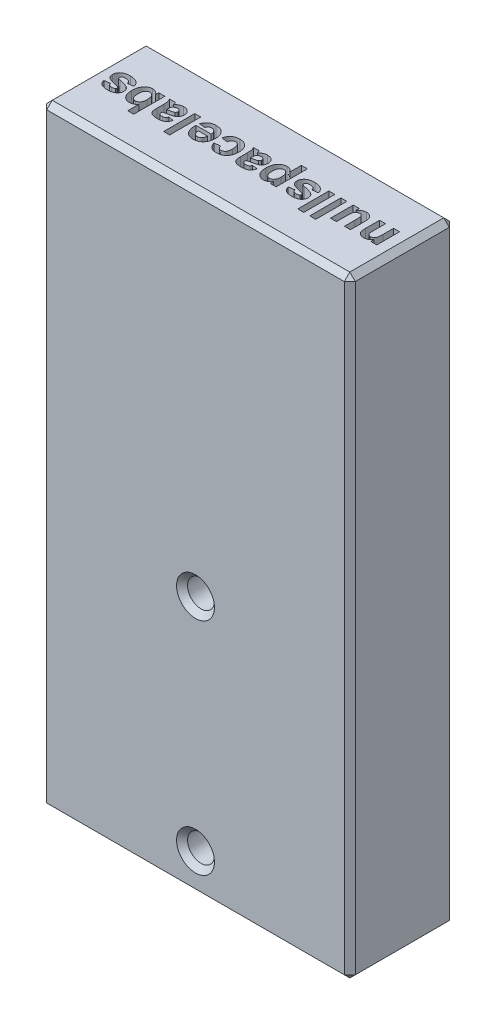
from build123d import *

# Parameters (mm, degrees)
SKETCH1_W           = 28
SKETCH1_H           = 55.475
BOSS_EXTRUDE1_DEPTH = 9.525
SKETCH2_R           = 1.2195
CUT_EXTRUDE1_DEPTH  = 20
SKETCH3_R           = 1.2195
CUT_EXTRUDE2_DEPTH  = 63.866535215
CHAMFER1_SIZE       = 0.5
CHAMFER2_SIZE       = 0.5
SKETCH4_W           = 0.543298183
SKETCH4_H           = 2.825150553
SKETCH4_W_2         = 0.543298184
CUT_EXTRUDE3_DEPTH  = 1.5875


with BuildPart() as part:
    # Sketch1 → Boss-Extrude1 (new body)
    with BuildSketch(Plane.XY):
        with Locations((14, 27.7375)):
            Rectangle(SKETCH1_W, SKETCH1_H)
    extrude(amount=BOSS_EXTRUDE1_DEPTH)

    # Sketch2 → Cut-Extrude1 (cut)
    with BuildSketch(Plane.XZ):
        with Locations((5, 4.7625)):
            Circle(SKETCH2_R)
        with Locations((23, 4.7625)):
            Circle(SKETCH2_R)
    extrude(amount=-CUT_EXTRUDE1_DEPTH, mode=Mode.SUBTRACT)

    # Sketch3 → Cut-Extrude2 (cut, through all)
    with BuildSketch(Plane.XY.offset(9.525)):
        with Locations((14, 3.475)):
            Circle(SKETCH3_R)
        with Locations((14, 23.475)):
            Circle(SKETCH3_R)
    extrude(amount=-CUT_EXTRUDE2_DEPTH, mode=Mode.SUBTRACT)

    # Chamfer1
    chamfer1_edges = [part.edges().sort_by_distance(p)[0] for p in [
        (14, 0, 0),
        (28, 0, 4.7625),
        (28, 27.7375, 0),
        (14, 55.475, 0),
        (28, 55.475, 4.7625),
        (28, 27.7375, 9.525),
        (14, 55.475, 9.525),
        (14, 0, 9.525),
        (0, 0, 4.7625),
        (0, 27.7375, 0),
        (0, 55.475, 4.7625),
        (0, 27.7375, 9.525),
    ]]
    chamfer(chamfer1_edges, length=CHAMFER1_SIZE)

    # Chamfer2
    chamfer2_edges = [part.edges().sort_by_distance(p)[0] for p in [
        (21.7805, 0, 4.7625),
        (3.7805, 0, 4.7625),
        (12.7805, 3.475, 0),
        (12.7805, 23.475, 0),
        (12.7805, 3.475, 9.525),
        (12.7805, 23.475, 9.525),
    ]]
    chamfer(chamfer2_edges, length=CHAMFER2_SIZE)

    # Sketch4 → Cut-Extrude3 (cut)
    # profile 1 of 13: a face of its own
    with BuildSketch(Plane(origin=(0, 55.475, 0), x_dir=(-1, 0, 0), z_dir=(0, 1, 0))):
        with BuildLine():
            Line((-24.781421278, 3.604081297), (-25.324719461, 3.604081297))
            Line((-25.324719461, 3.604081297), (-25.324719461, 4.663512754))
            add(Edge.make_bspline(
                [(-25.324719461, 4.663512754), (-25.324800701, 4.690301885), (-25.324955761, 4.741433597), (-25.326848857, 4.814249772), (-25.328886968, 4.879732028), (-25.3321634, 4.9376772), (-25.336663606, 4.988453041), (-25.342018688, 5.031743594), (-25.348764077, 5.067636842), (-25.358334688, 5.105073856), (-25.373361809, 5.144799809), (-25.397749784, 5.185945368), (-25.426021426, 5.222479857), (-25.460269303, 5.252367027), (-25.49865192, 5.276467486), (-25.5407946, 5.294234463), (-25.587005296, 5.304609524), (-25.61895282, 5.305801353), (-25.63541811, 5.306415605)],
                knots=[0, 0, 0, 0, 1.585090075, 3.025419896, 4.30986405, 5.461533023, 6.458985685, 7.325703005, 8.041573048, 8.618245387, 9.611190897, 10.541623111, 11.439410311, 12.333024322, 13.215695708, 14.111259627, 15.026570636, 16, 16, 16, 16], degree=3))
            add(Edge.make_bspline(
                [(-25.63541811, 5.306415605), (-25.656617157, 5.305363327), (-25.698363813, 5.303291108), (-25.75966224, 5.288937779), (-25.816913906, 5.2635167), (-25.870356846, 5.229581438), (-25.917481625, 5.1874434), (-25.957549451, 5.138230589), (-25.989151824, 5.082560419), (-26.008840988, 5.030580648), (-26.020524332, 4.983531769), (-26.028475228, 4.941037319), (-26.034171522, 4.891452971), (-26.040188151, 4.835282747), (-26.043582029, 4.771998131), (-26.047368963, 4.702225524), (-26.048763232, 4.62541148), (-26.048995555, 4.572019608), (-26.049117039, 4.544100341)],
                knots=[0, 0, 0, 0, 1.032418065, 2.033110358, 3.045378521, 4.070039643, 5.104744895, 6.110696385, 7.147805894, 8.209255037, 8.806501049, 9.507534436, 10.313289552, 11.236712342, 12.258650821, 13.399345464, 14.640085731, 16, 16, 16, 16], degree=3))
            Line((-26.049117039, 4.544100341), (-26.049117039, 3.604081297))
            Line((-26.049117039, 3.604081297), (-26.592415223, 3.604081297))
            Line((-26.592415223, 3.604081297), (-26.592415223, 5.668614394))
            Line((-26.592415223, 5.668614394), (-26.049117039, 5.668614394))
            Line((-26.049117039, 5.668614394), (-26.049117039, 5.370932264))
            add(Edge.make_bspline(
                [(-26.049117039, 5.370932264), (-26.028112454, 5.397397856), (-25.987193613, 5.448955235), (-25.918688016, 5.51747586), (-25.846134249, 5.57562659), (-25.769205102, 5.623094406), (-25.687940039, 5.659734813), (-25.602711265, 5.685540576), (-25.513448534, 5.702234715), (-25.452507965, 5.703957515), (-25.42149445, 5.704834272)],
                knots=[0, 0, 0, 0, 1.096260936, 2.135615983, 3.138008533, 4.108575778, 5.062498258, 6.023394349, 6.994077526, 8, 8, 8, 8], degree=3))
            add(Edge.make_bspline(
                [(-25.42149445, 5.704834272), (-25.394278108, 5.70414993), (-25.34068123, 5.702802262), (-25.26232215, 5.689866555), (-25.187503423, 5.669555655), (-25.117268188, 5.641225429), (-25.052698522, 5.60744186), (-24.995970031, 5.567941957), (-24.947208855, 5.524381335), (-24.907218545, 5.475475745), (-24.874660325, 5.42285056), (-24.846321483, 5.367626561), (-24.824422883, 5.308501971), (-24.807520093, 5.244257422), (-24.796061131, 5.171436776), (-24.786926296, 5.086850879), (-24.782317337, 4.988409639), (-24.781732424, 4.918187159), (-24.781421278, 4.880832028)],
                knots=[0, 0, 0, 0, 1.087471829, 2.141547729, 3.166311014, 4.181815879, 5.163737, 6.073971965, 6.939083136, 7.769667735, 8.590016746, 9.409741311, 10.247555639, 11.105633939, 12.06171977, 13.192085209, 14.506318385, 16, 16, 16, 16], degree=3))
            Line((-24.781421278, 4.880832028), (-24.781421278, 3.604081297))
        make_face()
    # profile 2 of 13: a face of its own
    with BuildSketch(Plane(origin=(0, 55.475, 0), x_dir=(-1, 0, 0), z_dir=(0, 1, 0))):
        with BuildLine():
            Line((-22.934207455, 3.604081297), (-22.934207455, 3.907988718))
            add(Edge.make_bspline(
                [(-22.934207455, 3.907988718), (-22.95219541, 3.881977239), (-22.987890248, 3.830360723), (-23.053486997, 3.762721781), (-23.126944314, 3.704031061), (-23.207750233, 3.655117075), (-23.293423572, 3.616104138), (-23.382529651, 3.588092974), (-23.474039435, 3.571266192), (-23.53591723, 3.568997988), (-23.566923464, 3.567861418)],
                knots=[0, 0, 0, 0, 1.012300957, 2.008784164, 3.006972158, 4.019128624, 5.028517728, 6.017265291, 7.006475003, 8, 8, 8, 8], degree=3))
            add(Edge.make_bspline(
                [(-23.566923464, 3.567861418), (-23.598317693, 3.568900652), (-23.659886562, 3.570938749), (-23.749595886, 3.588410916), (-23.834277599, 3.616968181), (-23.913510395, 3.656236229), (-23.984645838, 3.706496501), (-24.046574428, 3.76600582), (-24.096620454, 3.835689581), (-24.129861543, 3.900483044), (-24.150721347, 3.957449305), (-24.164057626, 4.004639904), (-24.176147787, 4.055751025), (-24.185424468, 4.110786084), (-24.19295033, 4.16968324), (-24.197678886, 4.232401949), (-24.201350923, 4.29919619), (-24.201715686, 4.345073957), (-24.201903216, 4.368660303)],
                knots=[0, 0, 0, 0, 1.289498181, 2.528902495, 3.740215999, 4.953909685, 6.150063847, 7.307074614, 8.467199117, 9.660131987, 10.288158488, 10.958106275, 11.674712228, 12.445953132, 13.25095176, 14.114470792, 15.030625377, 16, 16, 16, 16], degree=3))
            Line((-24.201903216, 4.368660303), (-24.201903216, 5.668614394))
            Line((-24.201903216, 5.668614394), (-23.658605032, 5.668614394))
            Line((-23.658605032, 5.668614394), (-23.658605032, 4.716144766))
            add(Edge.make_bspline(
                [(-23.658605032, 4.716144766), (-23.658445732, 4.681434153), (-23.658143573, 4.615595348), (-23.657263916, 4.522014327), (-23.654850151, 4.439200971), (-23.652271636, 4.366921297), (-23.648448273, 4.305199992), (-23.643490751, 4.25403946), (-23.63795673, 4.213434454), (-23.630390457, 4.173849659), (-23.614855476, 4.134120128), (-23.593457323, 4.091443201), (-23.564205273, 4.054809763), (-23.530366248, 4.022992727), (-23.490933625, 3.996627978), (-23.445447966, 3.97998014), (-23.395915357, 3.967553721), (-23.361011503, 3.966716569), (-23.342812963, 3.966280086)],
                knots=[0, 0, 0, 0, 1.799930418, 3.414093185, 4.852592097, 6.095879458, 7.164323302, 8.058836106, 8.760219181, 9.289718358, 10.143846288, 10.96209893, 11.756558504, 12.559405005, 13.365225682, 14.195378484, 15.059087384, 16, 16, 16, 16], degree=3))
            add(Edge.make_bspline(
                [(-23.342812963, 3.966280086), (-23.321800233, 3.967327292), (-23.280421791, 3.969389458), (-23.219946811, 3.983760405), (-23.163468591, 4.008718213), (-23.110804659, 4.04191708), (-23.064697362, 4.083020724), (-23.024659679, 4.128674824), (-22.99347173, 4.179409236), (-22.973585002, 4.226693669), (-22.96166786, 4.271477494), (-22.955129223, 4.315926619), (-22.947955119, 4.37019967), (-22.943568417, 4.435038576), (-22.938635585, 4.51008395), (-22.93625384, 4.595589057), (-22.93446147, 4.691423847), (-22.934295075, 4.758777262), (-22.934207455, 4.79424388)],
                knots=[0, 0, 0, 0, 0.960139447, 1.890714513, 2.821289579, 3.770841791, 4.723832156, 5.63466777, 6.536687779, 7.433335375, 7.968708987, 8.650470788, 9.484586637, 10.470508532, 11.619255361, 12.921832212, 14.379114108, 16, 16, 16, 16], degree=3))
            Line((-22.934207455, 4.79424388), (-22.934207455, 5.668614394))
            Line((-22.934207455, 5.668614394), (-22.390909271, 5.668614394))
            Line((-22.390909271, 5.668614394), (-22.390909271, 3.604081297))
            Line((-22.390909271, 3.604081297), (-22.934207455, 3.604081297))
        make_face()
    # profile 3 of 13: a face of its own
    with BuildSketch(Plane(origin=(0, 55.475, 0), x_dir=(-1, 0, 0), z_dir=(0, 1, 0))):
        with Locations((-21.539742118, 5.016656574)):
            Rectangle(SKETCH4_W, SKETCH4_H)
    # profile 4 of 13: a face of its own
    with BuildSketch(Plane(origin=(0, 55.475, 0), x_dir=(-1, 0, 0), z_dir=(0, 1, 0))):
        with Locations((-20.45314575, 5.016656574)):
            Rectangle(SKETCH4_W, SKETCH4_H)
    # profile 5 of 13: a face of its own
    with BuildSketch(Plane(origin=(0, 55.475, 0), x_dir=(-1, 0, 0), z_dir=(0, 1, 0))):
        with BuildLine():
            Line((-19.855517749, 4.219819238), (-19.312219566, 4.292258996))
            add(Edge.make_bspline(
                [(-19.312219566, 4.292258996), (-19.305699456, 4.266883326), (-19.293140098, 4.21800345), (-19.261327903, 4.151551941), (-19.221447656, 4.094006125), (-19.171196133, 4.046777795), (-19.110896296, 4.009597074), (-19.039652776, 3.984797574), (-18.958487397, 3.96854445), (-18.900685094, 3.967061556), (-18.870223856, 3.966280086)],
                knots=[0, 0, 0, 0, 1.039319445, 2.001988807, 2.911187514, 3.807680854, 4.723381073, 5.705509029, 6.790826147, 8, 8, 8, 8], degree=3))
            add(Edge.make_bspline(
                [(-18.870223856, 3.966280086), (-18.836930453, 3.966867536), (-18.774309846, 3.967972455), (-18.68748318, 3.983306626), (-18.612044708, 4.004607133), (-18.570616704, 4.030077258), (-18.551036173, 4.042115457)],
                knots=[0, 0, 0, 0, 1.198418162, 2.254070348, 3.174803892, 4, 4, 4, 4], degree=3))
            add(Edge.make_bspline(
                [(-18.551036173, 4.042115457), (-18.539867545, 4.051182242), (-18.518146916, 4.068815228), (-18.496105006, 4.104292545), (-18.481433281, 4.14323304), (-18.479933841, 4.171006967), (-18.479162351, 4.185297166)],
                knots=[0, 0, 0, 0, 1.030872991, 2.004830756, 2.973448591, 4, 4, 4, 4], degree=3))
            add(Edge.make_bspline(
                [(-18.479162351, 4.185297166), (-18.479532169, 4.194967834), (-18.480254515, 4.213857008), (-18.487813028, 4.240869352), (-18.500499289, 4.265283611), (-18.512266696, 4.279068969), (-18.518211908, 4.286033704)],
                knots=[0, 0, 0, 0, 1.045349703, 2.041822997, 3.010676005, 4, 4, 4, 4], degree=3))
            add(Edge.make_bspline(
                [(-18.518211908, 4.286033704), (-18.526879623, 4.292586838), (-18.547027048, 4.307819085), (-18.587332679, 4.324927397), (-18.639502084, 4.341569663), (-18.678853069, 4.351023065), (-18.700443174, 4.356209719)],
                knots=[0, 0, 0, 0, 0.66031085, 1.534841007, 2.647478808, 4, 4, 4, 4], degree=3))
            add(Edge.make_bspline(
                [(-18.700443174, 4.356209719), (-18.753126911, 4.367679319), (-18.853425226, 4.38951493), (-18.996022059, 4.424253884), (-19.123432672, 4.457879627), (-19.235975834, 4.490654048), (-19.333261915, 4.522308944), (-19.415297871, 4.554298962), (-19.48291829, 4.584117121), (-19.521044235, 4.607331057), (-19.538027873, 4.61767197)],
                knots=[0, 0, 0, 0, 1.469089687, 2.796825535, 3.998745421, 5.059265209, 5.990657066, 6.784841839, 7.458693894, 8, 8, 8, 8], degree=3))
            add(Edge.make_bspline(
                [(-19.538027873, 4.61767197), (-19.557402863, 4.631795148), (-19.595231873, 4.659370174), (-19.645619861, 4.706850857), (-19.688345139, 4.758475272), (-19.723278563, 4.814403044), (-19.749942122, 4.874500251), (-19.769439257, 4.938487953), (-19.78072959, 5.006637022), (-19.782285691, 5.05340132), (-19.783077991, 5.077211684)],
                knots=[0, 0, 0, 0, 1.056974227, 2.063706289, 3.045111424, 4.005796011, 4.963194591, 5.937303459, 6.949763919, 8, 8, 8, 8], degree=3))
            add(Edge.make_bspline(
                [(-19.783077991, 5.077211684), (-19.78238515, 5.098938294), (-19.781016686, 5.14185151), (-19.771393801, 5.204755804), (-19.75478551, 5.264936314), (-19.7313891, 5.32246415), (-19.701396827, 5.377341021), (-19.664626902, 5.429438514), (-19.621412346, 5.478566639), (-19.572073159, 5.525418119), (-19.515472052, 5.567850886), (-19.451444385, 5.604819197), (-19.380062414, 5.636033179), (-19.301449491, 5.661039889), (-19.215736868, 5.680999538), (-19.122810202, 5.694767076), (-19.022622313, 5.703343516), (-18.953434697, 5.704327132), (-18.917762447, 5.704834272)],
                knots=[0, 0, 0, 0, 0.866638136, 1.711736386, 2.531524902, 3.351865931, 4.183724929, 5.020979167, 5.890357771, 6.790086018, 7.73080449, 8.705352504, 9.73310627, 10.832638366, 11.99182341, 13.240303911, 14.577136024, 16, 16, 16, 16], degree=3))
            add(Edge.make_bspline(
                [(-18.917762447, 5.704834272), (-18.883793051, 5.704430997), (-18.817857757, 5.703648231), (-18.72246601, 5.696755509), (-18.633702269, 5.685942539), (-18.552005747, 5.669086931), (-18.476495419, 5.649576888), (-18.408287695, 5.623461607), (-18.345994984, 5.594821619), (-18.291261347, 5.559331839), (-18.241191227, 5.520583785), (-18.196034536, 5.476792217), (-18.154710363, 5.428856827), (-18.116056812, 5.377532455), (-18.083854838, 5.320274621), (-18.054067321, 5.259625496), (-18.02848335, 5.19431642), (-18.015123014, 5.148632955), (-18.008303926, 5.12531621)],
                knots=[0, 0, 0, 0, 1.380550213, 2.679676202, 3.885648221, 5.011984379, 6.068504557, 7.051214125, 7.977245523, 8.849391706, 9.696088241, 10.547493682, 11.400830533, 12.26732929, 13.153751704, 14.065965736, 15.012872933, 16, 16, 16, 16], degree=3))
            Line((-18.008303926, 5.12531621), (-18.551602109, 5.052876452))
            add(Edge.make_bspline(
                [(-18.551602109, 5.052876452), (-18.556994632, 5.072350625), (-18.567462954, 5.110155175), (-18.593288163, 5.161335082), (-18.625506441, 5.205482811), (-18.664649183, 5.242355752), (-18.711720058, 5.272352593), (-18.768259381, 5.291934766), (-18.833053861, 5.304708562), (-18.879208097, 5.305825158), (-18.903614057, 5.306415605)],
                knots=[0, 0, 0, 0, 1.018425325, 1.977034519, 2.876390575, 3.766006025, 4.677889232, 5.672509542, 6.769243204, 8, 8, 8, 8], degree=3))
            add(Edge.make_bspline(
                [(-18.903614057, 5.306415605), (-18.933864303, 5.306022434), (-18.990085553, 5.305291712), (-19.06716823, 5.293650899), (-19.132118761, 5.27748558), (-19.167096129, 5.256987656), (-19.183186247, 5.247558301)],
                knots=[0, 0, 0, 0, 1.252081424, 2.327041614, 3.230413832, 4, 4, 4, 4], degree=3))
            add(Edge.make_bspline(
                [(-19.183186247, 5.247558301), (-19.191893522, 5.240400538), (-19.208602291, 5.226665196), (-19.226641604, 5.200047446), (-19.238099485, 5.170549735), (-19.239213343, 5.149568772), (-19.239779808, 5.138898665)],
                knots=[0, 0, 0, 0, 1.057832138, 2.029920023, 2.998093444, 4, 4, 4, 4], degree=3))
            add(Edge.make_bspline(
                [(-19.239779808, 5.138898665), (-19.239091347, 5.129758359), (-19.237718259, 5.111528668), (-19.227584831, 5.085358286), (-19.210664449, 5.061429625), (-19.195230975, 5.048759545), (-19.187147796, 5.042123676)],
                knots=[0, 0, 0, 0, 0.958252903, 1.911167308, 2.905987877, 4, 4, 4, 4], degree=3))
            add(Edge.make_bspline(
                [(-19.187147796, 5.042123676), (-19.179525675, 5.037198763), (-19.161315254, 5.025432388), (-19.126247946, 5.011165917), (-19.08072547, 4.994727846), (-19.024167018, 4.976938237), (-18.956880135, 4.957083127), (-18.878549461, 4.936206781), (-18.789207093, 4.914368362), (-18.691883806, 4.891504819), (-18.592901095, 4.867835459), (-18.498942264, 4.842066662), (-18.413050404, 4.814224916), (-18.335167679, 4.785116605), (-18.265136688, 4.754365258), (-18.20278267, 4.723110068), (-18.148293635, 4.689950554), (-18.116736752, 4.664771188), (-18.101683301, 4.652759978)],
                knots=[0, 0, 0, 0, 0.374473465, 0.894674728, 1.558250729, 2.377018991, 3.344303564, 4.458456515, 5.727543487, 7.146141891, 8.591136569, 9.934411183, 11.172377707, 12.322386231, 13.369924362, 14.332482298, 15.204550818, 16, 16, 16, 16], degree=3))
            add(Edge.make_bspline(
                [(-18.101683301, 4.652759978), (-18.088311438, 4.640456116), (-18.06188962, 4.61614459), (-18.028615687, 4.573931866), (-17.999118863, 4.529267555), (-17.976280933, 4.480257282), (-17.957863472, 4.428185176), (-17.944811963, 4.372417294), (-17.937736496, 4.313003835), (-17.936496531, 4.27228012), (-17.935864168, 4.251511632)],
                knots=[0, 0, 0, 0, 0.971012965, 1.9186502, 2.868006896, 3.82989672, 4.803792202, 5.820095146, 6.888280979, 8, 8, 8, 8], degree=3))
            add(Edge.make_bspline(
                [(-17.935864168, 4.251511632), (-17.936706785, 4.228460967), (-17.938366728, 4.183051521), (-17.949123141, 4.116059827), (-17.968273364, 4.051922582), (-17.993471582, 3.989668208), (-18.027479639, 3.930506448), (-18.068537751, 3.873867033), (-18.116261147, 3.819087451), (-18.171689265, 3.767689604), (-18.234602329, 3.720751968), (-18.304404372, 3.679174596), (-18.381613505, 3.644677296), (-18.465789333, 3.616430011), (-18.557108824, 3.59463431), (-18.65545013, 3.578733424), (-18.760839897, 3.56999851), (-18.83342276, 3.56858772), (-18.870789792, 3.567861418)],
                knots=[0, 0, 0, 0, 0.853005228, 1.680406763, 2.502135431, 3.325285981, 4.159928718, 5.020072903, 5.910500533, 6.844018396, 7.811498054, 8.809909951, 9.84399402, 10.934451331, 12.090792638, 13.314110396, 14.617253208, 16, 16, 16, 16], degree=3))
            add(Edge.make_bspline(
                [(-18.870789792, 3.567861418), (-18.904946541, 3.568447378), (-18.971468549, 3.569588564), (-19.06852637, 3.577200561), (-19.159959586, 3.591603242), (-19.246041158, 3.610643076), (-19.326821942, 3.634771694), (-19.40198714, 3.664952805), (-19.471889516, 3.700466804), (-19.535903647, 3.741983999), (-19.59440935, 3.788075262), (-19.647820633, 3.838038893), (-19.696214312, 3.891806767), (-19.738579633, 3.949906217), (-19.776428056, 4.011430717), (-19.808462527, 4.07704632), (-19.835535509, 4.146693627), (-19.848779057, 4.195158792), (-19.855517749, 4.219819238)],
                knots=[0, 0, 0, 0, 1.275954772, 2.484986887, 3.63311568, 4.730696379, 5.776212371, 6.778566547, 7.752400714, 8.700396387, 9.623767345, 10.531135067, 11.42942751, 12.321590653, 13.213503293, 14.124285009, 15.045583181, 16, 16, 16, 16], degree=3))
        make_face()
    # profile 6 of 13: a face of its own
    with BuildSketch(Plane(origin=(0, 55.475, 0), x_dir=(-1, 0, 0), z_dir=(0, 1, 0))):
        with BuildLine():
            Line((-17.465005742, 5.668614394), (-16.921707559, 5.668614394))
            Line((-16.921707559, 5.668614394), (-16.921707559, 5.370932264))
            add(Edge.make_bspline(
                [(-16.921707559, 5.370932264), (-16.905538969, 5.395539089), (-16.87328984, 5.444618736), (-16.813806777, 5.50999362), (-16.745607234, 5.566790995), (-16.67063116, 5.616047915), (-16.589170655, 5.655853951), (-16.502513679, 5.684090615), (-16.41157175, 5.701751787), (-16.34943915, 5.703795406), (-16.317854266, 5.704834272)],
                knots=[0, 0, 0, 0, 0.978547196, 1.95176541, 2.927409496, 3.924956672, 4.929940552, 5.934297003, 6.949907262, 8, 8, 8, 8], degree=3))
            add(Edge.make_bspline(
                [(-16.317854266, 5.704834272), (-16.290259676, 5.703945639), (-16.235703738, 5.702188764), (-16.155592786, 5.688773008), (-16.078417551, 5.667290395), (-16.004453223, 5.636562836), (-15.933998382, 5.596538904), (-15.866881162, 5.548095219), (-15.803084497, 5.490893005), (-15.743075656, 5.425502749), (-15.687091619, 5.352920258), (-15.640088658, 5.271786378), (-15.598553455, 5.184853345), (-15.566395635, 5.090251445), (-15.53991693, 4.989349824), (-15.522571892, 4.881301149), (-15.510600055, 4.766783211), (-15.509630141, 4.688070176), (-15.509132282, 4.647666557)],
                knots=[0, 0, 0, 0, 0.889072898, 1.757743299, 2.610499059, 3.466435503, 4.33224962, 5.216506485, 6.129460723, 7.089031016, 8.074077693, 9.077254728, 10.105421072, 11.174607073, 12.292478541, 13.464028743, 14.698278956, 16, 16, 16, 16], degree=3))
            add(Edge.make_bspline(
                [(-15.509132282, 4.647666557), (-15.509886786, 4.606136804), (-15.511354153, 4.52536922), (-15.522870982, 4.407933291), (-15.54120381, 4.297532993), (-15.567745397, 4.194078633), (-15.602226355, 4.097633397), (-15.644158582, 4.00827985), (-15.693596421, 3.925944828), (-15.750809945, 3.851741218), (-15.812780187, 3.7850367), (-15.878645576, 3.726841282), (-15.947935176, 3.67791218), (-16.020450596, 3.637866022), (-16.096210126, 3.60660007), (-16.17506853, 3.583693439), (-16.257424058, 3.570547581), (-16.313281085, 3.56876561), (-16.341623561, 3.567861418)],
                knots=[0, 0, 0, 0, 1.306236862, 2.540385766, 3.708203967, 4.823704503, 5.895540064, 6.92555389, 7.923968911, 8.910318051, 9.867658815, 10.784332462, 11.670135407, 12.530710628, 13.384816116, 14.243178637, 15.10856933, 16, 16, 16, 16], degree=3))
            add(Edge.make_bspline(
                [(-16.341623561, 3.567861418), (-16.368478386, 3.568460379), (-16.421200677, 3.569636279), (-16.49807075, 3.583722995), (-16.571738993, 3.603391224), (-16.64224595, 3.633749392), (-16.71117443, 3.674345102), (-16.78071511, 3.726191739), (-16.85199949, 3.78973099), (-16.897751753, 3.838375539), (-16.921707559, 3.863845741)],
                knots=[0, 0, 0, 0, 0.955731574, 1.876324221, 2.77664122, 3.668156465, 4.602053939, 5.621192777, 6.754460664, 8, 8, 8, 8], degree=3))
            Line((-16.921707559, 3.863845741), (-16.921707559, 2.84346384))
            Line((-16.921707559, 2.84346384), (-17.465005742, 2.84346384))
            Line((-17.465005742, 2.84346384), (-17.465005742, 5.668614394))
        make_face()
        with BuildLine():
            add(Edge.make_bspline(
                [(-16.921707559, 4.671435853), (-16.921193713, 4.642376575), (-16.920198393, 4.586088729), (-16.914826957, 4.504613157), (-16.904852894, 4.428919856), (-16.889848129, 4.359288528), (-16.872372952, 4.294996348), (-16.849434511, 4.236946301), (-16.823136209, 4.184539487), (-16.792274265, 4.138531453), (-16.758713358, 4.098114834), (-16.723197491, 4.063099056), (-16.685984387, 4.033096435), (-16.646924204, 4.008582553), (-16.605732809, 3.989864248), (-16.562898035, 3.975947896), (-16.518107729, 3.968062949), (-16.487663756, 3.966876636), (-16.472354687, 3.966280086)],
                knots=[0, 0, 0, 0, 1.493314022, 2.892550594, 4.193549699, 5.412205958, 6.550654332, 7.612709232, 8.614154521, 9.557822924, 10.452682187, 11.309508678, 12.116407821, 12.904513946, 13.672267114, 14.435601522, 15.213325928, 16, 16, 16, 16], degree=3))
            add(Edge.make_bspline(
                [(-16.472354687, 3.966280086), (-16.457609258, 3.966663717), (-16.428493004, 3.967421234), (-16.385882645, 3.974974172), (-16.345170741, 3.987489489), (-16.306588365, 4.005353085), (-16.269468412, 4.027336695), (-16.234732807, 4.05500436), (-16.202006507, 4.08731753), (-16.17092908, 4.124592996), (-16.142708984, 4.167505422), (-16.118123589, 4.216856587), (-16.098188612, 4.272653788), (-16.081102394, 4.334469261), (-16.068425446, 4.402854933), (-16.058872146, 4.477282389), (-16.053181651, 4.558160109), (-16.052687353, 4.61407835), (-16.052430466, 4.643139072)],
                knots=[0, 0, 0, 0, 0.791529032, 1.562949534, 2.316249717, 3.073629172, 3.841847638, 4.628495664, 5.452636043, 6.309045487, 7.231005685, 8.205446327, 9.263518226, 10.409253672, 11.647529201, 12.996330553, 14.438992312, 16, 16, 16, 16], degree=3))
            add(Edge.make_bspline(
                [(-16.052430466, 4.643139072), (-16.052622457, 4.6703192), (-16.052993669, 4.722871517), (-16.05962662, 4.798981737), (-16.069039901, 4.869657742), (-16.081717339, 4.935268005), (-16.099211103, 4.995305678), (-16.120742169, 5.049812129), (-16.145605294, 5.099133377), (-16.174650058, 5.142717883), (-16.206177373, 5.181175782), (-16.240024756, 5.214491072), (-16.27564042, 5.242819677), (-16.313045233, 5.266450819), (-16.352691407, 5.283834106), (-16.393686352, 5.29739228), (-16.437022979, 5.304508539), (-16.466484993, 5.305774369), (-16.481409656, 5.306415605)],
                knots=[0, 0, 0, 0, 1.476295784, 2.854392948, 4.147416206, 5.349490113, 6.481481629, 7.53974865, 8.529905565, 9.47655935, 10.379475707, 11.227490418, 12.051885202, 12.848277861, 13.623614998, 14.398342141, 15.188643247, 16, 16, 16, 16], degree=3))
            add(Edge.make_bspline(
                [(-16.481409656, 5.306415605), (-16.496920719, 5.306108858), (-16.527404183, 5.305506017), (-16.571929708, 5.296908421), (-16.61474757, 5.284657499), (-16.655683309, 5.267047533), (-16.694241857, 5.244132041), (-16.731094458, 5.216672757), (-16.765296975, 5.18368116), (-16.797813, 5.146213965), (-16.827369525, 5.103711196), (-16.85268309, 5.055920852), (-16.874198289, 5.003587365), (-16.891736712, 4.946565735), (-16.905259141, 4.884654261), (-16.914435662, 4.81784557), (-16.921155091, 4.746274623), (-16.92151943, 4.696920237), (-16.921707559, 4.671435853)],
                knots=[0, 0, 0, 0, 0.85780786, 1.685826084, 2.502493326, 3.321563322, 4.145881477, 4.981773268, 5.861261435, 6.772452983, 7.726031601, 8.721727942, 9.761775197, 10.855694188, 12.021877455, 13.2675473, 14.589084357, 16, 16, 16, 16], degree=3))
        make_face(mode=Mode.SUBTRACT)
    # profile 7 of 13: a face of its own
    with BuildSketch(Plane(origin=(0, 55.475, 0), x_dir=(-1, 0, 0), z_dir=(0, 1, 0))):
        with BuildLine():
            Line((-14.712294947, 5.052876452), (-15.183153372, 5.12531621))
            add(Edge.make_bspline(
                [(-15.183153372, 5.12531621), (-15.17609688, 5.149181713), (-15.16228394, 5.195897948), (-15.136936974, 5.262842736), (-15.107255932, 5.324733135), (-15.074521953, 5.382308527), (-15.037726391, 5.4349395), (-14.997457352, 5.482762968), (-14.95348725, 5.525615257), (-14.905605944, 5.563828116), (-14.852892248, 5.597774089), (-14.79414955, 5.626553519), (-14.72946589, 5.650786208), (-14.658932087, 5.6702608), (-14.582666477, 5.686542312), (-14.500085312, 5.696509607), (-14.411721226, 5.703704447), (-14.350867174, 5.704450273), (-14.319535635, 5.704834272)],
                knots=[0, 0, 0, 0, 1.047140172, 2.049755565, 3.008539736, 3.933190086, 4.833981818, 5.707167246, 6.560530269, 7.413560864, 8.281243119, 9.193714071, 10.161006392, 11.183910126, 12.270717139, 13.439589873, 14.681737877, 16, 16, 16, 16], degree=3))
            add(Edge.make_bspline(
                [(-14.319535635, 5.704834272), (-14.29104508, 5.704676091), (-14.235920332, 5.704370035), (-14.156060855, 5.700357511), (-14.081826233, 5.693778085), (-14.013313591, 5.684052529), (-13.950297125, 5.672487224), (-13.892978091, 5.657821154), (-13.841185841, 5.640513557), (-13.781343263, 5.613609239), (-13.715609707, 5.575801833), (-13.64700254, 5.524465949), (-13.591958944, 5.466068836), (-13.555530565, 5.411565837), (-13.534017424, 5.362164967), (-13.518837016, 5.318639893), (-13.507929791, 5.267785293), (-13.497194504, 5.210329285), (-13.490606596, 5.145960992), (-13.484661193, 5.074664615), (-13.481441236, 4.996500292), (-13.481031595, 4.941955352), (-13.480819064, 4.913656293)],
                knots=[0, 0, 0, 0, 1.253259065, 2.424859341, 3.516580225, 4.530621704, 5.468151732, 6.333678254, 7.13150538, 7.867126506, 9.216626747, 10.459871386, 11.622324159, 12.731817101, 13.322505456, 13.989117254, 14.756090433, 15.607496751, 16.559714447, 17.600403876, 18.755039204, 20, 20, 20, 20], degree=3))
            Line((-13.480819064, 4.913656293), (-13.480819064, 4.279242477))
            add(Edge.make_bspline(
                [(-13.480819064, 4.279242477), (-13.480643078, 4.257360322), (-13.48030322, 4.21510239), (-13.47960654, 4.153946524), (-13.476451932, 4.097366363), (-13.473137595, 4.045292191), (-13.46931919, 3.997520835), (-13.464364034, 3.954272813), (-13.458163426, 3.915360885), (-13.448215402, 3.868888307), (-13.432213448, 3.812504499), (-13.40605002, 3.744919703), (-13.374664861, 3.674524067), (-13.349117178, 3.62805189), (-13.335939549, 3.604081297)],
                knots=[0, 0, 0, 0, 1.124218554, 2.171045354, 3.141373911, 4.034856482, 4.851737235, 5.603038048, 6.270604849, 6.87504238, 8.043824301, 9.276776929, 10.59534724, 12, 12, 12, 12], degree=3))
            Line((-13.335939549, 3.604081297), (-13.879237732, 3.604081297))
            add(Edge.make_bspline(
                [(-13.879237732, 3.604081297), (-13.883115566, 3.614988811), (-13.891612695, 3.638889409), (-13.903088099, 3.678953193), (-13.91684062, 3.725632358), (-13.925907769, 3.759314821), (-13.930737873, 3.777257593)],
                knots=[0, 0, 0, 0, 0.768508203, 1.683958961, 2.766236402, 4, 4, 4, 4], degree=3))
            add(Edge.make_bspline(
                [(-13.930737873, 3.777257593), (-13.932820235, 3.785178786), (-13.936589482, 3.799516798), (-13.941612364, 3.819017981), (-13.945966918, 3.833927242), (-13.948827972, 3.842346604), (-13.949979683, 3.845735801)],
                knots=[0, 0, 0, 0, 1.381357368, 2.500370598, 3.396327181, 4, 4, 4, 4], degree=3))
            add(Edge.make_bspline(
                [(-13.949979683, 3.845735801), (-13.972963558, 3.82357684), (-14.01793914, 3.780215476), (-14.09129065, 3.724058146), (-14.166230149, 3.675713749), (-14.243975041, 3.636259188), (-14.323940682, 3.605423556), (-14.406918732, 3.583920898), (-14.492465612, 3.570541316), (-14.550577512, 3.568759471), (-14.579866015, 3.567861418)],
                knots=[0, 0, 0, 0, 1.082260538, 2.117802027, 3.127898709, 4.103827344, 5.070056335, 6.029309159, 7.006768236, 8, 8, 8, 8], degree=3))
            add(Edge.make_bspline(
                [(-14.579866015, 3.567861418), (-14.605348983, 3.568451264), (-14.655121018, 3.569603321), (-14.72774915, 3.577213565), (-14.79601862, 3.591647174), (-14.860242118, 3.61084326), (-14.920575383, 3.634976482), (-14.976497128, 3.66529777), (-15.028335418, 3.701127298), (-15.075575719, 3.742333883), (-15.117915384, 3.787560208), (-15.155073209, 3.835680789), (-15.185812046, 3.887340942), (-15.211242145, 3.941544808), (-15.231362481, 3.998766926), (-15.245241332, 4.058746981), (-15.254088162, 4.121649594), (-15.255084035, 4.164515692), (-15.25559313, 4.186429037)],
                knots=[0, 0, 0, 0, 1.186431605, 2.317277787, 3.39378889, 4.430144672, 5.434756152, 6.413230964, 7.385260177, 8.362630794, 9.325691837, 10.265445477, 11.187216893, 12.118354241, 13.048828682, 14.005299944, 14.980300216, 16, 16, 16, 16], degree=3))
            add(Edge.make_bspline(
                [(-15.25559313, 4.186429037), (-15.254668487, 4.215177377), (-15.25285416, 4.271587148), (-15.237002978, 4.353539442), (-15.2121808, 4.430951108), (-15.176900819, 4.502851093), (-15.133001924, 4.568595707), (-15.080191099, 4.626626838), (-15.01922946, 4.67603828), (-14.948785778, 4.717999857), (-14.866166853, 4.753347425), (-14.769679032, 4.787399454), (-14.656973075, 4.817918083), (-14.576180859, 4.835379072), (-14.533459295, 4.844612149)],
                knots=[0, 0, 0, 0, 0.9565892, 1.877012003, 2.769038917, 3.656897043, 4.535078379, 5.39337207, 6.259743944, 7.138913465, 8.11486349, 9.247429708, 10.544487161, 12, 12, 12, 12], degree=3))
            add(Edge.make_bspline(
                [(-14.533459295, 4.844612149), (-14.504021113, 4.850602381), (-14.447353649, 4.862133368), (-14.365953546, 4.879470644), (-14.29158816, 4.896945281), (-14.224573078, 4.914697377), (-14.164199616, 4.930826319), (-14.111097881, 4.947079172), (-14.065058335, 4.963436848), (-14.03709227, 4.975049115), (-14.024117248, 4.980436695)],
                knots=[0, 0, 0, 0, 1.365613701, 2.628758346, 3.783158308, 4.837685682, 5.780080249, 6.623655076, 7.36143661, 8, 8, 8, 8], degree=3))
            Line((-14.024117248, 4.980436695), (-14.024117248, 5.031936835))
            add(Edge.make_bspline(
                [(-14.024117248, 5.031936835), (-14.02484121, 5.055025062), (-14.02618565, 5.097901212), (-14.039551611, 5.157355138), (-14.062753482, 5.206324876), (-14.090759558, 5.238962902), (-14.118468808, 5.258651679), (-14.142935837, 5.271755233), (-14.171606701, 5.282212814), (-14.20407867, 5.291481598), (-14.240909824, 5.297815321), (-14.281674994, 5.303074579), (-14.326483459, 5.305655184), (-14.35763982, 5.306155204), (-14.373865453, 5.306415605)],
                knots=[0, 0, 0, 0, 1.600506204, 2.972230995, 4.195852174, 5.327580964, 5.908906329, 6.547275261, 7.247479517, 8.022494018, 8.887774365, 9.837646189, 10.873887764, 12, 12, 12, 12], degree=3))
            add(Edge.make_bspline(
                [(-14.373865453, 5.306415605), (-14.39542617, 5.305900412), (-14.436397119, 5.304921412), (-14.494134932, 5.293967661), (-14.544939323, 5.276797157), (-14.588976013, 5.251161978), (-14.626938972, 5.216336873), (-14.659995512, 5.171428885), (-14.689279965, 5.116242478), (-14.70433468, 5.074793067), (-14.712294947, 5.052876452)],
                knots=[0, 0, 0, 0, 1.120680009, 2.129582446, 3.045508635, 3.899130849, 4.760899303, 5.707254252, 6.787697471, 8, 8, 8, 8], degree=3))
        make_face()
        with BuildLine():
            add(Edge.make_bspline(
                [(-14.024117248, 4.582018027), (-14.042763876, 4.576259776), (-14.084761049, 4.563290661), (-14.155304103, 4.544236201), (-14.24033355, 4.524157127), (-14.318744914, 4.506782995), (-14.384201603, 4.4926718), (-14.430376815, 4.481134175), (-14.47198632, 4.470132714), (-14.50909234, 4.458579466), (-14.541744536, 4.44770406), (-14.569467543, 4.436050804), (-14.593226309, 4.425846683), (-14.606552285, 4.417304005), (-14.61269028, 4.413369216)],
                knots=[0, 0, 0, 0, 1.144223484, 2.577096135, 4.283377528, 6.266557578, 7.286341447, 8.209198618, 9.057088726, 9.80932547, 10.487940513, 11.073343897, 11.57317876, 12, 12, 12, 12], degree=3))
            add(Edge.make_bspline(
                [(-14.61269028, 4.413369216), (-14.6278856, 4.401401307), (-14.657047296, 4.378433414), (-14.688836924, 4.334048451), (-14.709009441, 4.28484114), (-14.711186368, 4.250008177), (-14.712294947, 4.232269821)],
                knots=[0, 0, 0, 0, 1.075028234, 2.063111864, 3.013658082, 4, 4, 4, 4], degree=3))
            add(Edge.make_bspline(
                [(-14.712294947, 4.232269821), (-14.711317176, 4.214620536), (-14.709399205, 4.180000128), (-14.694122501, 4.130113483), (-14.668433196, 4.084409638), (-14.633444702, 4.0437793), (-14.591342957, 4.008604005), (-14.541714679, 3.984494608), (-14.487039446, 3.968926876), (-14.448682267, 3.967184829), (-14.428761207, 3.966280086)],
                knots=[0, 0, 0, 0, 0.976809721, 1.916086158, 2.861451878, 3.862738809, 4.873423621, 5.878632484, 6.898253484, 8, 8, 8, 8], degree=3))
            add(Edge.make_bspline(
                [(-14.428761207, 3.966280086), (-14.405997966, 3.967310085), (-14.360171263, 3.969383668), (-14.292960365, 3.988329978), (-14.226602323, 4.016294459), (-14.186310147, 4.043816257), (-14.16560115, 4.057961654)],
                knots=[0, 0, 0, 0, 0.962503947, 1.937702252, 2.940039444, 4, 4, 4, 4], degree=3))
            add(Edge.make_bspline(
                [(-14.16560115, 4.057961654), (-14.150975692, 4.069736079), (-14.12253884, 4.092629554), (-14.088646107, 4.134465186), (-14.060677089, 4.178968321), (-14.049530286, 4.211799003), (-14.043924994, 4.228308272)],
                knots=[0, 0, 0, 0, 1.055399509, 2.052054707, 3.020454315, 4, 4, 4, 4], degree=3))
            add(Edge.make_bspline(
                [(-14.043924994, 4.228308272), (-14.040835708, 4.241846989), (-14.033604093, 4.273539349), (-14.028502014, 4.329332329), (-14.024374752, 4.399530651), (-14.024208306, 4.451275478), (-14.024117248, 4.479583682)],
                knots=[0, 0, 0, 0, 0.659054705, 1.542760655, 2.655710416, 4, 4, 4, 4], degree=3))
            Line((-14.024117248, 4.479583682), (-14.024117248, 4.582018027))
        make_face(mode=Mode.SUBTRACT)
    # profile 8 of 13: a face of its own
    with BuildSketch(Plane(origin=(0, 55.475, 0), x_dir=(-1, 0, 0), z_dir=(0, 1, 0))):
        with BuildLine():
            Line((-11.198966694, 5.052876452), (-11.742264878, 4.980436695))
            add(Edge.make_bspline(
                [(-11.742264878, 4.980436695), (-11.747258324, 5.005879479), (-11.75678464, 5.054418299), (-11.780938753, 5.121636386), (-11.813973479, 5.178768085), (-11.855286335, 5.225445265), (-11.903914595, 5.261819204), (-11.959148206, 5.288343804), (-12.021578828, 5.303773115), (-12.065326604, 5.305512221), (-12.088051534, 5.306415605)],
                knots=[0, 0, 0, 0, 1.183520367, 2.2578771, 3.246797608, 4.180863388, 5.085846032, 6.003342148, 6.962829327, 8, 8, 8, 8], degree=3))
            add(Edge.make_bspline(
                [(-12.088051534, 5.306415605), (-12.103541868, 5.30599029), (-12.1337361, 5.305161253), (-12.177902552, 5.298404042), (-12.219276293, 5.286153926), (-12.258915094, 5.270562678), (-12.295515641, 5.249325946), (-12.330162211, 5.224224103), (-12.361769905, 5.193870327), (-12.391400686, 5.159177333), (-12.418644757, 5.119167285), (-12.440722382, 5.072343059), (-12.460080959, 5.019901759), (-12.475814248, 4.961161123), (-12.487944214, 4.896245971), (-12.497073706, 4.825215513), (-12.501952113, 4.748095314), (-12.502564527, 4.694645617), (-12.502882334, 4.666908368)],
                knots=[0, 0, 0, 0, 0.862078219, 1.680389174, 2.478024961, 3.259954283, 4.04533088, 4.826625376, 5.636266677, 6.477958853, 7.363321064, 8.321359119, 9.351280941, 10.472100686, 11.701575432, 13.024867311, 14.456081111, 16, 16, 16, 16], degree=3))
            add(Edge.make_bspline(
                [(-12.502882334, 4.666908368), (-12.502638102, 4.636148636), (-12.502167159, 4.576836109), (-12.496301008, 4.491294443), (-12.487558853, 4.412866749), (-12.475240078, 4.341337495), (-12.459056128, 4.276958457), (-12.439211241, 4.21939451), (-12.416508183, 4.168451937), (-12.388651072, 4.125093256), (-12.358800795, 4.087159157), (-12.325188391, 4.055513486), (-12.290482105, 4.027070023), (-12.251908321, 4.005322918), (-12.211763491, 3.987150006), (-12.16847773, 3.975849979), (-12.12329823, 3.967153922), (-12.092058713, 3.966574727), (-12.076166886, 3.966280086)],
                knots=[0, 0, 0, 0, 1.594318435, 3.074248329, 4.44256617, 5.683784585, 6.834147545, 7.879495874, 8.83778105, 9.716843238, 10.544636748, 11.333080285, 12.105903466, 12.864046512, 13.621684801, 14.38335177, 15.177596319, 16, 16, 16, 16], degree=3))
            add(Edge.make_bspline(
                [(-12.076166886, 3.966280086), (-12.05284971, 3.967282605), (-12.007624445, 3.969227061), (-11.943404883, 3.98664865), (-11.885721158, 4.014861352), (-11.843891898, 4.048031679), (-11.813514456, 4.079976577), (-11.793727832, 4.10940131), (-11.773822296, 4.141595369), (-11.757488384, 4.178849385), (-11.741221274, 4.219384174), (-11.72820773, 4.264484297), (-11.71528186, 4.313005858), (-11.709189871, 4.347098883), (-11.706044999, 4.364698753)],
                knots=[0, 0, 0, 0, 1.391704634, 2.699306801, 3.945045311, 5.206156062, 5.868460975, 6.572467336, 7.320954464, 8.128297893, 8.999513781, 9.930638866, 10.931732014, 12, 12, 12, 12], degree=3))
            Line((-11.706044999, 4.364698753), (-11.162746816, 4.292258996))
            add(Edge.make_bspline(
                [(-11.162746816, 4.292258996), (-11.169899159, 4.263287025), (-11.183916517, 4.206506966), (-11.211160559, 4.124969185), (-11.242961514, 4.048757366), (-11.278950383, 3.977656219), (-11.320471741, 3.912433706), (-11.366373344, 3.852639911), (-11.417159209, 3.798628908), (-11.472175871, 3.749554322), (-11.532281293, 3.706428301), (-11.597567624, 3.669598399), (-11.667080962, 3.637651898), (-11.741966762, 3.612498252), (-11.821293972, 3.591770706), (-11.905815574, 3.578119204), (-11.995051652, 3.569352314), (-12.056148438, 3.568366865), (-12.087485598, 3.567861418)],
                knots=[0, 0, 0, 0, 1.110268429, 2.175934317, 3.195555169, 4.181481111, 5.137790904, 6.068820232, 6.982751273, 7.892872169, 8.808581235, 9.729898078, 10.678730826, 11.651191499, 12.666063818, 13.726769105, 14.834036833, 16, 16, 16, 16], degree=3))
            add(Edge.make_bspline(
                [(-12.087485598, 3.567861418), (-12.123181165, 3.568727317), (-12.192743938, 3.570414764), (-12.294337191, 3.583673005), (-12.390382443, 3.605468027), (-12.480899858, 3.637000894), (-12.566272713, 3.676318871), (-12.645623033, 3.725699571), (-12.719382463, 3.783640725), (-12.787378777, 3.849975283), (-12.848572047, 3.923981443), (-12.90139769, 4.005610015), (-12.946221389, 4.093841985), (-12.98315941, 4.188766895), (-13.011332013, 4.290836974), (-13.03132825, 4.39953481), (-13.044229627, 4.514928269), (-13.045519022, 4.594055539), (-13.046180518, 4.634650038)],
                knots=[0, 0, 0, 0, 1.056003706, 2.057917874, 3.026125023, 3.965316587, 4.889355399, 5.801804771, 6.724223409, 7.659808022, 8.607570672, 9.559810849, 10.530974559, 11.531347954, 12.568834288, 13.659317828, 14.799164681, 16, 16, 16, 16], degree=3))
            add(Edge.make_bspline(
                [(-13.046180518, 4.634650038), (-13.045517302, 4.675621634), (-13.044224276, 4.755501127), (-13.031359752, 4.871836007), (-13.011385214, 4.981309615), (-12.982971744, 5.083773005), (-12.947064005, 5.179411947), (-12.901903099, 5.26762655), (-12.849160156, 5.349294312), (-12.787916052, 5.423254862), (-12.720122437, 5.489649243), (-12.645921049, 5.547123086), (-12.566380488, 5.596233744), (-12.480762478, 5.635827657), (-12.389630915, 5.667296936), (-12.292627654, 5.689012263), (-12.189910576, 5.702281207), (-12.119596592, 5.703968603), (-12.083524049, 5.704834272)],
                knots=[0, 0, 0, 0, 1.206261992, 2.351765734, 3.442553085, 4.480484798, 5.479315179, 6.445885781, 7.393622348, 8.336902565, 9.26806234, 10.182699256, 11.09556262, 12.0152312, 12.955233282, 13.92969179, 14.937888647, 16, 16, 16, 16], degree=3))
            add(Edge.make_bspline(
                [(-12.083524049, 5.704834272), (-12.054072706, 5.70453401), (-11.996564835, 5.703947705), (-11.912690984, 5.695475124), (-11.833363307, 5.683523121), (-11.758642452, 5.665784585), (-11.688495145, 5.6434001), (-11.623041332, 5.615691952), (-11.562547637, 5.582453198), (-11.506247614, 5.544626398), (-11.454472406, 5.501010474), (-11.406153853, 5.452912741), (-11.361831216, 5.399154578), (-11.320983308, 5.340465403), (-11.284968348, 5.2759014), (-11.251863764, 5.206680615), (-11.223135057, 5.131809759), (-11.207142445, 5.079578264), (-11.198966694, 5.052876452)],
                knots=[0, 0, 0, 0, 1.178528697, 2.301242291, 3.371523624, 4.388184023, 5.372173667, 6.316227488, 7.228761945, 8.131556558, 9.02696084, 9.934795517, 10.857276148, 11.812560878, 12.793328268, 13.813516901, 14.882225015, 16, 16, 16, 16], degree=3))
        make_face()
    # profile 9 of 13: a face of its own
    with BuildSketch(Plane(origin=(0, 55.475, 0), x_dir=(-1, 0, 0), z_dir=(0, 1, 0))):
        with BuildLine():
            Line((-9.569072144, 4.256039117), (-9.025773961, 4.183599359))
            add(Edge.make_bspline(
                [(-9.025773961, 4.183599359), (-9.034660362, 4.159120955), (-9.052132921, 4.110991195), (-9.0840554, 4.042363953), (-9.119738448, 3.978313227), (-9.159010518, 3.918496793), (-9.201725455, 3.86283661), (-9.249295679, 3.812503532), (-9.299403789, 3.765623825), (-9.354145788, 3.72442975), (-9.412150037, 3.687382619), (-9.473708036, 3.654966772), (-9.539312076, 3.628566954), (-9.6079687, 3.606458892), (-9.67998955, 3.588812209), (-9.755668454, 3.576475443), (-9.83490832, 3.568979988), (-9.888997568, 3.568238973), (-9.916556608, 3.567861418)],
                knots=[0, 0, 0, 0, 1.071172907, 2.106154283, 3.1104349, 4.085737425, 5.048416355, 5.993087888, 6.932482331, 7.868664062, 8.80754521, 9.762367971, 10.726735429, 11.713584758, 12.728370439, 13.774815933, 14.866245336, 16, 16, 16, 16], degree=3))
            add(Edge.make_bspline(
                [(-9.916556608, 3.567861418), (-9.959622222, 3.568924357), (-10.043252368, 3.570988505), (-10.164245755, 3.587576064), (-10.276622887, 3.614582671), (-10.380600201, 3.652410684), (-10.475832096, 3.702031541), (-10.562461973, 3.76236942), (-10.640659726, 3.833555454), (-10.684489689, 3.888670961), (-10.706602716, 3.916477752)],
                knots=[0, 0, 0, 0, 1.150944905, 2.235047425, 3.25761485, 4.235688044, 5.185329112, 6.119879054, 7.051444229, 8, 8, 8, 8], degree=3))
            add(Edge.make_bspline(
                [(-10.706602716, 3.916477752), (-10.722922135, 3.940141164), (-10.755784681, 3.987792366), (-10.796634034, 4.065004073), (-10.831563646, 4.146569945), (-10.859390775, 4.23272362), (-10.882522829, 4.323137758), (-10.89808639, 4.418386758), (-10.907056753, 4.518270731), (-10.908480994, 4.5863384), (-10.909207663, 4.621067584)],
                knots=[0, 0, 0, 0, 0.92479112, 1.862259343, 2.806490716, 3.778329015, 4.774107667, 5.808532634, 6.881879269, 8, 8, 8, 8], degree=3))
            add(Edge.make_bspline(
                [(-10.909207663, 4.621067584), (-10.90861003, 4.662235892), (-10.907441721, 4.74271551), (-10.893609878, 4.859705306), (-10.874092355, 4.970334845), (-10.844326818, 5.073454807), (-10.807123878, 5.170241483), (-10.760432742, 5.259450245), (-10.706575812, 5.342703783), (-10.643604753, 5.417487747), (-10.574596166, 5.484730262), (-10.501158085, 5.5439822), (-10.422740745, 5.593473246), (-10.340512153, 5.634780757), (-10.253104088, 5.665700346), (-10.161610539, 5.688461223), (-10.065631466, 5.70232229), (-10.000172167, 5.703988163), (-9.966924877, 5.704834272)],
                knots=[0, 0, 0, 0, 1.222152375, 2.389176539, 3.494777592, 4.555389183, 5.572001132, 6.56945427, 7.540785438, 8.511469914, 9.46642023, 10.399267108, 11.30862844, 12.215760073, 13.126777173, 14.056336669, 15.012798191, 16, 16, 16, 16], degree=3))
            add(Edge.make_bspline(
                [(-9.966924877, 5.704834272), (-9.92971441, 5.704047536), (-9.856897427, 5.702507976), (-9.75073053, 5.688054733), (-9.650490712, 5.664546191), (-9.556505406, 5.630765765), (-9.468161746, 5.58840675), (-9.386116774, 5.535911304), (-9.31036628, 5.473758829), (-9.24109733, 5.401975827), (-9.178407749, 5.321034304), (-9.125049143, 5.22937296), (-9.080380616, 5.127939193), (-9.044167238, 5.016471492), (-9.017395111, 4.894736497), (-8.999076503, 4.763051013), (-8.988629703, 4.621427124), (-8.989239531, 4.52374372), (-8.989554082, 4.47335839)],
                knots=[0, 0, 0, 0, 0.994942504, 1.946998194, 2.860087576, 3.744358974, 4.613292, 5.475605888, 6.343365869, 7.228414471, 8.138836547, 9.075277299, 10.058013037, 11.098483422, 12.205225682, 13.387753975, 14.652597341, 16, 16, 16, 16], degree=3))
            Line((-8.989554082, 4.47335839), (-10.36590948, 4.47335839))
            add(Edge.make_bspline(
                [(-10.36590948, 4.47335839), (-10.365018475, 4.453912357), (-10.363283403, 4.416044693), (-10.356711099, 4.3606924), (-10.345333319, 4.308880096), (-10.33044349, 4.260293443), (-10.312738032, 4.214898348), (-10.290215289, 4.173130716), (-10.264266194, 4.134457704), (-10.234267404, 4.099509954), (-10.201421176, 4.068486629), (-10.16676101, 4.041223004), (-10.130340106, 4.017383128), (-10.091217506, 3.999251382), (-10.050693918, 3.983941167), (-10.008039838, 3.974127539), (-9.963540762, 3.967606404), (-9.933181779, 3.966728243), (-9.917688479, 3.966280086)],
                knots=[0, 0, 0, 0, 1.231756261, 2.398624542, 3.522625857, 4.583815436, 5.612473245, 6.600564899, 7.580690863, 8.554470542, 9.508734211, 10.435415665, 11.342824763, 12.255949018, 13.158633635, 14.07945191, 15.019874036, 16, 16, 16, 16], degree=3))
            add(Edge.make_bspline(
                [(-9.917688479, 3.966280086), (-9.897067011, 3.967194451), (-9.857126304, 3.968965439), (-9.799554463, 3.981373848), (-9.747317674, 4.003240765), (-9.69986858, 4.033725842), (-9.657648337, 4.074210064), (-9.622251037, 4.125774901), (-9.591302163, 4.186810556), (-9.576725959, 4.232203665), (-9.569072144, 4.256039117)],
                knots=[0, 0, 0, 0, 1.004430367, 1.945431754, 2.851730883, 3.749038912, 4.678525969, 5.68064125, 6.782128749, 8, 8, 8, 8], degree=3))
        make_face()
        with BuildLine():
            add(Edge.make_bspline(
                [(-9.532852266, 4.7993373), (-9.533787316, 4.819345085), (-9.535608391, 4.858311644), (-9.541548676, 4.915124792), (-9.551746131, 4.968078722), (-9.565158777, 5.017459019), (-9.583055418, 5.062657791), (-9.603036144, 5.104970501), (-9.627539954, 5.143079634), (-9.655609453, 5.176897631), (-9.685218403, 5.20780837), (-9.717948467, 5.233512651), (-9.751042419, 5.25651605), (-9.786212014, 5.274922652), (-9.823092907, 5.288985309), (-9.861560894, 5.299324535), (-9.90168317, 5.304864728), (-9.928803371, 5.305892929), (-9.942589645, 5.306415605)],
                knots=[0, 0, 0, 0, 1.317025077, 2.564998298, 3.752245872, 4.859831213, 5.924126069, 6.944952788, 7.932526842, 8.893486968, 9.832088588, 10.740700482, 11.624936399, 12.479435602, 13.343337491, 14.21592381, 15.09308328, 16, 16, 16, 16], degree=3))
            add(Edge.make_bspline(
                [(-9.942589645, 5.306415605), (-9.957322671, 5.305937366), (-9.986354833, 5.304994973), (-10.028929635, 5.298846033), (-10.069284311, 5.287939816), (-10.107726407, 5.273178802), (-10.144173538, 5.253740094), (-10.178626521, 5.229900915), (-10.21121497, 5.20195973), (-10.230851004, 5.180791229), (-10.240837711, 5.170025123)],
                knots=[0, 0, 0, 0, 1.043516863, 2.056302107, 3.038302912, 3.998520634, 4.966791607, 5.956307719, 6.960596886, 8, 8, 8, 8], degree=3))
            add(Edge.make_bspline(
                [(-10.240837711, 5.170025123), (-10.250145992, 5.15832081), (-10.268847489, 5.134805386), (-10.292566502, 5.095815878), (-10.313227409, 5.054140659), (-10.328624275, 5.008654542), (-10.342145847, 4.960831631), (-10.350077518, 4.90952902), (-10.355420651, 4.855480687), (-10.355993803, 4.818405224), (-10.356288575, 4.7993373)],
                knots=[0, 0, 0, 0, 0.903873942, 1.815995408, 2.755131859, 3.711650387, 4.716574161, 5.757841734, 6.846857195, 8, 8, 8, 8], degree=3))
            Line((-10.356288575, 4.7993373), (-9.532852266, 4.7993373))
        make_face(mode=Mode.SUBTRACT)
    # profile 10 of 13: a face of its own
    with BuildSketch(Plane(origin=(0, 55.475, 0), x_dir=(-1, 0, 0), z_dir=(0, 1, 0))):
        with Locations((-8.283266444, 5.016656574)):
            Rectangle(SKETCH4_W_2, SKETCH4_H)
    # profile 11 of 13: a face of its own
    with BuildSketch(Plane(origin=(0, 55.475, 0), x_dir=(-1, 0, 0), z_dir=(0, 1, 0))):
        with BuildLine():
            Line((-7.10612038, 5.052876452), (-7.576978805, 5.12531621))
            add(Edge.make_bspline(
                [(-7.576978805, 5.12531621), (-7.569922313, 5.149181713), (-7.556109374, 5.195897948), (-7.530762407, 5.262842736), (-7.501081365, 5.324733135), (-7.468347386, 5.382308527), (-7.431551824, 5.4349395), (-7.391282785, 5.482762968), (-7.347312683, 5.525615257), (-7.299431377, 5.563828116), (-7.246717681, 5.597774089), (-7.187974983, 5.626553519), (-7.123291323, 5.650786208), (-7.05275752, 5.6702608), (-6.976491911, 5.686542312), (-6.893910745, 5.696509607), (-6.805546659, 5.703704447), (-6.744692608, 5.704450273), (-6.713361068, 5.704834272)],
                knots=[0, 0, 0, 0, 1.047140172, 2.049755565, 3.008539736, 3.933190086, 4.833981818, 5.707167246, 6.560530269, 7.413560864, 8.281243119, 9.193714071, 10.161006392, 11.183910126, 12.270717139, 13.439589873, 14.681737877, 16, 16, 16, 16], degree=3))
            add(Edge.make_bspline(
                [(-6.713361068, 5.704834272), (-6.684870513, 5.704676091), (-6.629745765, 5.704370035), (-6.549886288, 5.700357511), (-6.475651666, 5.693778085), (-6.407139024, 5.684052529), (-6.344122559, 5.672487224), (-6.286803524, 5.657821154), (-6.235011274, 5.640513557), (-6.175168697, 5.613609239), (-6.109435141, 5.575801833), (-6.040827973, 5.524465949), (-5.985784378, 5.466068836), (-5.949355998, 5.411565837), (-5.927842857, 5.362164967), (-5.912662449, 5.318639893), (-5.901755224, 5.267785293), (-5.891019938, 5.210329285), (-5.884432029, 5.145960992), (-5.878486626, 5.074664615), (-5.875266669, 4.996500292), (-5.874857028, 4.941955352), (-5.874644498, 4.913656293)],
                knots=[0, 0, 0, 0, 1.253259065, 2.424859341, 3.516580225, 4.530621704, 5.468151732, 6.333678254, 7.13150538, 7.867126506, 9.216626747, 10.459871386, 11.622324159, 12.731817101, 13.322505456, 13.989117254, 14.756090433, 15.607496751, 16.559714447, 17.600403876, 18.755039204, 20, 20, 20, 20], degree=3))
            Line((-5.874644498, 4.913656293), (-5.874644498, 4.279242477))
            add(Edge.make_bspline(
                [(-5.874644498, 4.279242477), (-5.874468511, 4.257360322), (-5.874128653, 4.21510239), (-5.873431974, 4.153946524), (-5.870277365, 4.097366363), (-5.866963028, 4.045292191), (-5.863144623, 3.997520835), (-5.858189467, 3.954272813), (-5.85198886, 3.915360885), (-5.842040835, 3.868888307), (-5.826038881, 3.812504499), (-5.799875453, 3.744919703), (-5.768490294, 3.674524067), (-5.742942611, 3.62805189), (-5.729764982, 3.604081297)],
                knots=[0, 0, 0, 0, 1.124218554, 2.171045354, 3.141373911, 4.034856482, 4.851737235, 5.603038048, 6.270604849, 6.87504238, 8.043824301, 9.276776929, 10.59534724, 12, 12, 12, 12], degree=3))
            Line((-5.729764982, 3.604081297), (-6.273063165, 3.604081297))
            add(Edge.make_bspline(
                [(-6.273063165, 3.604081297), (-6.276940999, 3.614988811), (-6.285438128, 3.638889409), (-6.296913532, 3.678953193), (-6.310666053, 3.725632358), (-6.319733202, 3.759314821), (-6.324563306, 3.777257593)],
                knots=[0, 0, 0, 0, 0.768508203, 1.683958961, 2.766236402, 4, 4, 4, 4], degree=3))
            add(Edge.make_bspline(
                [(-6.324563306, 3.777257593), (-6.326645668, 3.785178786), (-6.330414915, 3.799516798), (-6.335437797, 3.819017981), (-6.339792351, 3.833927242), (-6.342653405, 3.842346604), (-6.343805116, 3.845735801)],
                knots=[0, 0, 0, 0, 1.381357368, 2.500370598, 3.396327181, 4, 4, 4, 4], degree=3))
            add(Edge.make_bspline(
                [(-6.343805116, 3.845735801), (-6.366788992, 3.82357684), (-6.411764574, 3.780215476), (-6.485116083, 3.724058146), (-6.560055582, 3.675713749), (-6.637800475, 3.636259188), (-6.717766115, 3.605423556), (-6.800744165, 3.583920898), (-6.886291045, 3.570541316), (-6.944402945, 3.568759471), (-6.973691448, 3.567861418)],
                knots=[0, 0, 0, 0, 1.082260538, 2.117802027, 3.127898709, 4.103827344, 5.070056335, 6.029309159, 7.006768236, 8, 8, 8, 8], degree=3))
            add(Edge.make_bspline(
                [(-6.973691448, 3.567861418), (-6.999174416, 3.568451264), (-7.048946452, 3.569603321), (-7.121574583, 3.577213565), (-7.189844053, 3.591647174), (-7.254067551, 3.61084326), (-7.314400817, 3.634976482), (-7.370322561, 3.66529777), (-7.422160851, 3.701127298), (-7.469401152, 3.742333883), (-7.511740817, 3.787560208), (-7.548898642, 3.835680789), (-7.579637479, 3.887340942), (-7.605067578, 3.941544808), (-7.625187914, 3.998766926), (-7.639066765, 4.058746981), (-7.647913595, 4.121649594), (-7.648909468, 4.164515692), (-7.649418563, 4.186429037)],
                knots=[0, 0, 0, 0, 1.186431605, 2.317277787, 3.39378889, 4.430144672, 5.434756152, 6.413230964, 7.385260177, 8.362630794, 9.325691837, 10.265445477, 11.187216893, 12.118354241, 13.048828682, 14.005299944, 14.980300216, 16, 16, 16, 16], degree=3))
            add(Edge.make_bspline(
                [(-7.649418563, 4.186429037), (-7.64849392, 4.215177377), (-7.646679594, 4.271587148), (-7.630828411, 4.353539442), (-7.606006233, 4.430951108), (-7.570726252, 4.502851093), (-7.526827357, 4.568595707), (-7.474016532, 4.626626838), (-7.413054894, 4.67603828), (-7.342611211, 4.717999857), (-7.259992286, 4.753347425), (-7.163504465, 4.787399454), (-7.050798508, 4.817918083), (-6.970006292, 4.835379072), (-6.927284728, 4.844612149)],
                knots=[0, 0, 0, 0, 0.9565892, 1.877012003, 2.769038917, 3.656897043, 4.535078379, 5.39337207, 6.259743944, 7.138913465, 8.11486349, 9.247429708, 10.544487161, 12, 12, 12, 12], degree=3))
            add(Edge.make_bspline(
                [(-6.927284728, 4.844612149), (-6.897846546, 4.850602381), (-6.841179082, 4.862133368), (-6.759778979, 4.879470644), (-6.685413594, 4.896945281), (-6.618398511, 4.914697377), (-6.558025049, 4.930826319), (-6.504923315, 4.947079172), (-6.458883768, 4.963436848), (-6.430917703, 4.975049115), (-6.417942681, 4.980436695)],
                knots=[0, 0, 0, 0, 1.365613701, 2.628758346, 3.783158308, 4.837685682, 5.780080249, 6.623655076, 7.36143661, 8, 8, 8, 8], degree=3))
            Line((-6.417942681, 4.980436695), (-6.417942681, 5.031936835))
            add(Edge.make_bspline(
                [(-6.417942681, 5.031936835), (-6.418666644, 5.055025062), (-6.420011083, 5.097901212), (-6.433377044, 5.157355138), (-6.456578915, 5.206324876), (-6.484584991, 5.238962902), (-6.512294242, 5.258651679), (-6.53676127, 5.271755233), (-6.565432134, 5.282212814), (-6.597904103, 5.291481598), (-6.634735257, 5.297815321), (-6.675500427, 5.303074579), (-6.720308892, 5.305655184), (-6.751465253, 5.306155204), (-6.767690887, 5.306415605)],
                knots=[0, 0, 0, 0, 1.600506204, 2.972230995, 4.195852174, 5.327580964, 5.908906329, 6.547275261, 7.247479517, 8.022494018, 8.887774365, 9.837646189, 10.873887764, 12, 12, 12, 12], degree=3))
            add(Edge.make_bspline(
                [(-6.767690887, 5.306415605), (-6.789251603, 5.305900412), (-6.830222552, 5.304921412), (-6.887960365, 5.293967661), (-6.938764756, 5.276797157), (-6.982801446, 5.251161978), (-7.020764405, 5.216336873), (-7.053820945, 5.171428885), (-7.083105399, 5.116242478), (-7.098160113, 5.074793067), (-7.10612038, 5.052876452)],
                knots=[0, 0, 0, 0, 1.120680009, 2.129582446, 3.045508635, 3.899130849, 4.760899303, 5.707254252, 6.787697471, 8, 8, 8, 8], degree=3))
        make_face()
        with BuildLine():
            add(Edge.make_bspline(
                [(-6.417942681, 4.582018027), (-6.436589309, 4.576259776), (-6.478586482, 4.563290661), (-6.549129536, 4.544236201), (-6.634158983, 4.524157127), (-6.712570347, 4.506782995), (-6.778027036, 4.4926718), (-6.824202248, 4.481134175), (-6.865811753, 4.470132714), (-6.902917773, 4.458579466), (-6.935569969, 4.44770406), (-6.963292976, 4.436050804), (-6.987051742, 4.425846683), (-7.000377719, 4.417304005), (-7.006515713, 4.413369216)],
                knots=[0, 0, 0, 0, 1.144223484, 2.577096135, 4.283377528, 6.266557578, 7.286341447, 8.209198618, 9.057088726, 9.80932547, 10.487940513, 11.073343897, 11.57317876, 12, 12, 12, 12], degree=3))
            add(Edge.make_bspline(
                [(-7.006515713, 4.413369216), (-7.021711034, 4.401401307), (-7.050872729, 4.378433414), (-7.082662357, 4.334048451), (-7.102834874, 4.28484114), (-7.105011801, 4.250008177), (-7.10612038, 4.232269821)],
                knots=[0, 0, 0, 0, 1.075028234, 2.063111864, 3.013658082, 4, 4, 4, 4], degree=3))
            add(Edge.make_bspline(
                [(-7.10612038, 4.232269821), (-7.105142609, 4.214620536), (-7.103224638, 4.180000128), (-7.087947935, 4.130113483), (-7.062258629, 4.084409638), (-7.027270135, 4.0437793), (-6.98516839, 4.008604005), (-6.935540112, 3.984494608), (-6.880864879, 3.968926876), (-6.8425077, 3.967184829), (-6.82258664, 3.966280086)],
                knots=[0, 0, 0, 0, 0.976809721, 1.916086158, 2.861451878, 3.862738809, 4.873423621, 5.878632484, 6.898253484, 8, 8, 8, 8], degree=3))
            add(Edge.make_bspline(
                [(-6.82258664, 3.966280086), (-6.7998234, 3.967310085), (-6.753996696, 3.969383668), (-6.686785798, 3.988329978), (-6.620427756, 4.016294459), (-6.58013558, 4.043816257), (-6.559426583, 4.057961654)],
                knots=[0, 0, 0, 0, 0.962503947, 1.937702252, 2.940039444, 4, 4, 4, 4], degree=3))
            add(Edge.make_bspline(
                [(-6.559426583, 4.057961654), (-6.544801125, 4.069736079), (-6.516364273, 4.092629554), (-6.48247154, 4.134465186), (-6.454502522, 4.178968321), (-6.443355719, 4.211799003), (-6.437750427, 4.228308272)],
                knots=[0, 0, 0, 0, 1.055399509, 2.052054707, 3.020454315, 4, 4, 4, 4], degree=3))
            add(Edge.make_bspline(
                [(-6.437750427, 4.228308272), (-6.434661141, 4.241846989), (-6.427429526, 4.273539349), (-6.422327447, 4.329332329), (-6.418200185, 4.399530651), (-6.418033739, 4.451275478), (-6.417942681, 4.479583682)],
                knots=[0, 0, 0, 0, 0.659054705, 1.542760655, 2.655710416, 4, 4, 4, 4], degree=3))
            Line((-6.417942681, 4.479583682), (-6.417942681, 4.582018027))
        make_face(mode=Mode.SUBTRACT)
    # profile 12 of 13: a face of its own
    with BuildSketch(Plane(origin=(0, 55.475, 0), x_dir=(-1, 0, 0), z_dir=(0, 1, 0))):
        with BuildLine():
            Line((-5.295126435, 3.604081297), (-5.295126435, 6.42923185))
            Line((-5.295126435, 6.42923185), (-4.751828252, 6.42923185))
            Line((-4.751828252, 6.42923185), (-4.751828252, 5.422432404))
            add(Edge.make_bspline(
                [(-4.751828252, 5.422432404), (-4.731490807, 5.4449118), (-4.691865014, 5.488711003), (-4.62661058, 5.546338567), (-4.558710187, 5.595398897), (-4.487512397, 5.635034452), (-4.413931015, 5.666866688), (-4.337260283, 5.688729763), (-4.257676453, 5.702215502), (-4.203679074, 5.703952585), (-4.176271739, 5.704834272)],
                knots=[0, 0, 0, 0, 1.09742733, 2.138244462, 3.14714167, 4.12618092, 5.084514129, 6.044794579, 7.007600552, 8, 8, 8, 8], degree=3))
            add(Edge.make_bspline(
                [(-4.176271739, 5.704834272), (-4.146597829, 5.704223033), (-4.088456795, 5.703025413), (-4.003390357, 5.689166071), (-3.922087877, 5.668561942), (-3.844432073, 5.639050671), (-3.771289171, 5.600078606), (-3.701666563, 5.553483088), (-3.636379969, 5.498077916), (-3.575228621, 5.434800159), (-3.519769758, 5.363325987), (-3.470767341, 5.284435434), (-3.430111328, 5.197677849), (-3.396719283, 5.103837972), (-3.370782146, 5.002481143), (-3.352265496, 4.89385418), (-3.341672874, 4.777853272), (-3.340075044, 4.698245115), (-3.339252975, 4.657287463)],
                knots=[0, 0, 0, 0, 0.942730505, 1.847121823, 2.733183872, 3.606606819, 4.481367714, 5.363155244, 6.265634696, 7.198966623, 8.156505419, 9.137011998, 10.145934455, 11.197093156, 12.299939524, 13.468576766, 14.697606431, 16, 16, 16, 16], degree=3))
            add(Edge.make_bspline(
                [(-3.339252975, 4.657287463), (-3.340081129, 4.614823193), (-3.341688672, 4.532395086), (-3.352156961, 4.412416366), (-3.371077993, 4.300165305), (-3.395917256, 4.19502898), (-3.429516666, 4.097684756), (-3.470398341, 4.007943863), (-3.517857815, 3.924990323), (-3.57335913, 3.850674507), (-3.633994986, 3.784699397), (-3.697373615, 3.726330199), (-3.764517251, 3.677211545), (-3.835154466, 3.637533769), (-3.908627747, 3.605851735), (-3.985461618, 3.583885343), (-4.065445265, 3.570493713), (-4.119814611, 3.568747622), (-4.147409023, 3.567861418)],
                knots=[0, 0, 0, 0, 1.342990017, 2.606900428, 3.804454117, 4.940338677, 6.01953414, 7.05541413, 8.055152764, 9.03596787, 9.981868581, 10.885627531, 11.756739119, 12.606254667, 13.442893865, 14.281233033, 15.127663507, 16, 16, 16, 16], degree=3))
            add(Edge.make_bspline(
                [(-4.147409023, 3.567861418), (-4.175015924, 3.568861802), (-4.230459079, 3.570870882), (-4.313246593, 3.586694975), (-4.394979975, 3.613309913), (-4.475923149, 3.648531095), (-4.553856495, 3.694842879), (-4.625911727, 3.753569298), (-4.693666084, 3.82219182), (-4.732122913, 3.875178767), (-4.751828252, 3.902329362)],
                knots=[0, 0, 0, 0, 0.921157575, 1.849967926, 2.801929881, 3.785969375, 4.79143669, 5.817208272, 6.881534093, 8, 8, 8, 8], degree=3))
            Line((-4.751828252, 3.902329362), (-4.751828252, 3.604081297))
            Line((-4.751828252, 3.604081297), (-5.295126435, 3.604081297))
        make_face()
        with BuildLine():
            add(Edge.make_bspline(
                [(-4.751828252, 4.675397402), (-4.751491, 4.648790195), (-4.750839901, 4.597422369), (-4.746197836, 4.523228408), (-4.739282612, 4.454375716), (-4.7280651, 4.391054957), (-4.715986574, 4.332420174), (-4.698283893, 4.279834825), (-4.679948472, 4.23168364), (-4.663525283, 4.203045195), (-4.655619199, 4.189258715)],
                knots=[0, 0, 0, 0, 1.27404814, 2.459675089, 3.559050391, 4.585286877, 5.538680085, 6.421449734, 7.240089651, 8, 8, 8, 8], degree=3))
            add(Edge.make_bspline(
                [(-4.655619199, 4.189258715), (-4.644300579, 4.171631811), (-4.62233578, 4.13742522), (-4.584042268, 4.091962472), (-4.54338781, 4.052889878), (-4.499064743, 4.021652331), (-4.452853792, 3.996108), (-4.40294987, 3.979375707), (-4.350910127, 3.967978988), (-4.314988828, 3.966850828), (-4.296816024, 3.966280086)],
                knots=[0, 0, 0, 0, 1.13317841, 2.199034441, 3.210601728, 4.17712673, 5.127651621, 6.057985678, 7.017523073, 8, 8, 8, 8], degree=3))
            add(Edge.make_bspline(
                [(-4.296816024, 3.966280086), (-4.282632585, 3.966646481), (-4.254818315, 3.967364998), (-4.213930684, 3.975117433), (-4.174577238, 3.987626637), (-4.136783984, 4.005192526), (-4.10062356, 4.027530601), (-4.066471175, 4.055141293), (-4.03383332, 4.087478698), (-4.002261133, 4.124298201), (-3.974068392, 4.167075972), (-3.948874442, 4.215245643), (-3.929017619, 4.269902141), (-3.91116045, 4.329463787), (-3.898674274, 4.395130559), (-3.888915601, 4.46612958), (-3.883352995, 4.542879608), (-3.882823868, 4.595969234), (-3.882551159, 4.623331326)],
                knots=[0, 0, 0, 0, 0.78356255, 1.536596371, 2.292155343, 3.062338243, 3.835342336, 4.636962799, 5.485351512, 6.373661662, 7.314050153, 8.312593822, 9.372473365, 10.524658142, 11.748175488, 13.064264604, 14.486938588, 16, 16, 16, 16], degree=3))
            add(Edge.make_bspline(
                [(-3.882551159, 4.623331326), (-3.882806473, 4.652581229), (-3.883297867, 4.708877363), (-3.889000075, 4.790125079), (-3.898462536, 4.865179657), (-3.911840512, 4.933833629), (-3.928778849, 4.996371394), (-3.949577348, 5.052555167), (-3.974219766, 5.102730859), (-4.003444254, 5.146129426), (-4.035581118, 5.183446473), (-4.068634256, 5.216834499), (-4.104934849, 5.244096916), (-4.142898055, 5.26703695), (-4.183431323, 5.284758281), (-4.226283816, 5.296971003), (-4.271014698, 5.305463715), (-4.301680496, 5.306095885), (-4.317189705, 5.306415605)],
                knots=[0, 0, 0, 0, 1.541669275, 2.967189997, 4.290690924, 5.527159073, 6.651403144, 7.702408128, 8.680806828, 9.590976681, 10.451726763, 11.274471125, 12.062089487, 12.838070645, 13.608488225, 14.385742736, 15.183590336, 16, 16, 16, 16], degree=3))
            add(Edge.make_bspline(
                [(-4.317189705, 5.306415605), (-4.332500614, 5.306042342), (-4.362554349, 5.305309666), (-4.406657092, 5.297676505), (-4.448568694, 5.285174634), (-4.488768774, 5.268104064), (-4.526705406, 5.245688618), (-4.563236496, 5.219116949), (-4.597303763, 5.187077883), (-4.628891293, 5.150221973), (-4.658140484, 5.108580556), (-4.683482713, 5.061718246), (-4.704381782, 5.009371485), (-4.72179015, 4.952396563), (-4.73538235, 4.890314542), (-4.74463138, 4.823134171), (-4.751245581, 4.750986614), (-4.751630362, 4.70106946), (-4.751828252, 4.675397402)],
                knots=[0, 0, 0, 0, 0.853654749, 1.675636261, 2.488263676, 3.289909134, 4.105938102, 4.941754496, 5.805666242, 6.708768126, 7.646124924, 8.639937881, 9.673965161, 10.786053658, 11.960883777, 13.21578984, 14.568099356, 16, 16, 16, 16], degree=3))
        make_face(mode=Mode.SUBTRACT)
    # profile 13 of 13: a face of its own
    with BuildSketch(Plane(origin=(0, 55.475, 0), x_dir=(-1, 0, 0), z_dir=(0, 1, 0))):
        with BuildLine():
            Line((-3.121933702, 4.219819238), (-2.578635519, 4.292258996))
            add(Edge.make_bspline(
                [(-2.578635519, 4.292258996), (-2.572115409, 4.266883326), (-2.559556051, 4.21800345), (-2.527743856, 4.151551941), (-2.487863609, 4.094006125), (-2.437612086, 4.046777795), (-2.377312249, 4.009597074), (-2.306068729, 3.984797574), (-2.22490335, 3.96854445), (-2.167101047, 3.967061556), (-2.136639809, 3.966280086)],
                knots=[0, 0, 0, 0, 1.039319445, 2.001988807, 2.911187514, 3.807680854, 4.723381073, 5.705509029, 6.790826147, 8, 8, 8, 8], degree=3))
            add(Edge.make_bspline(
                [(-2.136639809, 3.966280086), (-2.103346406, 3.966867536), (-2.040725799, 3.967972455), (-1.953899133, 3.983306626), (-1.878460661, 4.004607133), (-1.837032657, 4.030077258), (-1.817452126, 4.042115457)],
                knots=[0, 0, 0, 0, 1.198418162, 2.254070348, 3.174803892, 4, 4, 4, 4], degree=3))
            add(Edge.make_bspline(
                [(-1.817452126, 4.042115457), (-1.806283498, 4.051182242), (-1.784562869, 4.068815228), (-1.762520959, 4.104292545), (-1.747849234, 4.14323304), (-1.746349794, 4.171006967), (-1.745578304, 4.185297166)],
                knots=[0, 0, 0, 0, 1.030872991, 2.004830756, 2.973448591, 4, 4, 4, 4], degree=3))
            add(Edge.make_bspline(
                [(-1.745578304, 4.185297166), (-1.745948122, 4.194967834), (-1.746670468, 4.213857008), (-1.754228981, 4.240869352), (-1.766915242, 4.265283611), (-1.778682649, 4.279068969), (-1.784627861, 4.286033704)],
                knots=[0, 0, 0, 0, 1.045349703, 2.041822997, 3.010676005, 4, 4, 4, 4], degree=3))
            add(Edge.make_bspline(
                [(-1.784627861, 4.286033704), (-1.793295576, 4.292586838), (-1.813443001, 4.307819085), (-1.853748632, 4.324927397), (-1.905918037, 4.341569663), (-1.945269022, 4.351023065), (-1.966859127, 4.356209719)],
                knots=[0, 0, 0, 0, 0.66031085, 1.534841007, 2.647478808, 4, 4, 4, 4], degree=3))
            add(Edge.make_bspline(
                [(-1.966859127, 4.356209719), (-2.019542864, 4.367679319), (-2.119841179, 4.38951493), (-2.262438012, 4.424253884), (-2.389848625, 4.457879627), (-2.502391787, 4.490654048), (-2.599677868, 4.522308944), (-2.681713824, 4.554298962), (-2.749334244, 4.584117121), (-2.787460188, 4.607331057), (-2.804443826, 4.61767197)],
                knots=[0, 0, 0, 0, 1.469089687, 2.796825535, 3.998745421, 5.059265209, 5.990657066, 6.784841839, 7.458693894, 8, 8, 8, 8], degree=3))
            add(Edge.make_bspline(
                [(-2.804443826, 4.61767197), (-2.823818816, 4.631795148), (-2.861647826, 4.659370174), (-2.912035814, 4.706850857), (-2.954761092, 4.758475272), (-2.989694516, 4.814403044), (-3.016358075, 4.874500251), (-3.03585521, 4.938487953), (-3.047145543, 5.006637022), (-3.048701644, 5.05340132), (-3.049493944, 5.077211684)],
                knots=[0, 0, 0, 0, 1.056974227, 2.063706289, 3.045111424, 4.005796011, 4.963194591, 5.937303459, 6.949763919, 8, 8, 8, 8], degree=3))
            add(Edge.make_bspline(
                [(-3.049493944, 5.077211684), (-3.048801103, 5.098938294), (-3.047432639, 5.14185151), (-3.037809754, 5.204755804), (-3.021201463, 5.264936314), (-2.997805053, 5.32246415), (-2.96781278, 5.377341021), (-2.931042855, 5.429438514), (-2.887828299, 5.478566639), (-2.838489112, 5.525418119), (-2.781888006, 5.567850886), (-2.717860338, 5.604819197), (-2.646478367, 5.636033179), (-2.567865444, 5.661039889), (-2.482152821, 5.680999538), (-2.389226155, 5.694767076), (-2.289038266, 5.703343516), (-2.21985065, 5.704327132), (-2.1841784, 5.704834272)],
                knots=[0, 0, 0, 0, 0.866638136, 1.711736386, 2.531524902, 3.351865931, 4.183724929, 5.020979167, 5.890357771, 6.790086018, 7.73080449, 8.705352504, 9.73310627, 10.832638366, 11.99182341, 13.240303911, 14.577136024, 16, 16, 16, 16], degree=3))
            add(Edge.make_bspline(
                [(-2.1841784, 5.704834272), (-2.150209004, 5.704430997), (-2.08427371, 5.703648231), (-1.988881963, 5.696755509), (-1.900118222, 5.685942539), (-1.8184217, 5.669086931), (-1.742911372, 5.649576888), (-1.674703648, 5.623461607), (-1.612410937, 5.594821619), (-1.5576773, 5.559331839), (-1.50760718, 5.520583785), (-1.462450489, 5.476792217), (-1.421126316, 5.428856827), (-1.382472765, 5.377532455), (-1.350270791, 5.320274621), (-1.320483274, 5.259625496), (-1.294899303, 5.19431642), (-1.281538967, 5.148632955), (-1.274719879, 5.12531621)],
                knots=[0, 0, 0, 0, 1.380550213, 2.679676202, 3.885648221, 5.011984379, 6.068504557, 7.051214125, 7.977245523, 8.849391706, 9.696088241, 10.547493682, 11.400830533, 12.26732929, 13.153751704, 14.065965736, 15.012872933, 16, 16, 16, 16], degree=3))
            Line((-1.274719879, 5.12531621), (-1.818018062, 5.052876452))
            add(Edge.make_bspline(
                [(-1.818018062, 5.052876452), (-1.823410585, 5.072350625), (-1.833878907, 5.110155175), (-1.859704116, 5.161335082), (-1.891922394, 5.205482811), (-1.931065136, 5.242355752), (-1.978136011, 5.272352593), (-2.034675334, 5.291934766), (-2.099469814, 5.304708562), (-2.14562405, 5.305825158), (-2.17003001, 5.306415605)],
                knots=[0, 0, 0, 0, 1.018425325, 1.977034519, 2.876390575, 3.766006025, 4.677889232, 5.672509542, 6.769243204, 8, 8, 8, 8], degree=3))
            add(Edge.make_bspline(
                [(-2.17003001, 5.306415605), (-2.200280257, 5.306022434), (-2.256501506, 5.305291712), (-2.333584183, 5.293650899), (-2.398534714, 5.27748558), (-2.433512082, 5.256987656), (-2.4496022, 5.247558301)],
                knots=[0, 0, 0, 0, 1.252081424, 2.327041614, 3.230413832, 4, 4, 4, 4], degree=3))
            add(Edge.make_bspline(
                [(-2.4496022, 5.247558301), (-2.458309475, 5.240400538), (-2.475018244, 5.226665196), (-2.493057557, 5.200047446), (-2.504515438, 5.170549735), (-2.505629296, 5.149568772), (-2.506195761, 5.138898665)],
                knots=[0, 0, 0, 0, 1.057832138, 2.029920023, 2.998093444, 4, 4, 4, 4], degree=3))
            add(Edge.make_bspline(
                [(-2.506195761, 5.138898665), (-2.5055073, 5.129758359), (-2.504134212, 5.111528668), (-2.494000784, 5.085358286), (-2.477080402, 5.061429625), (-2.461646928, 5.048759545), (-2.453563749, 5.042123676)],
                knots=[0, 0, 0, 0, 0.958252903, 1.911167308, 2.905987877, 4, 4, 4, 4], degree=3))
            add(Edge.make_bspline(
                [(-2.453563749, 5.042123676), (-2.445941628, 5.037198763), (-2.427731207, 5.025432388), (-2.392663899, 5.011165917), (-2.347141423, 4.994727846), (-2.290582971, 4.976938237), (-2.223296088, 4.957083127), (-2.144965415, 4.936206781), (-2.055623046, 4.914368362), (-1.958299759, 4.891504819), (-1.859317048, 4.867835459), (-1.765358217, 4.842066662), (-1.679466357, 4.814224916), (-1.601583633, 4.785116605), (-1.531552641, 4.754365258), (-1.469198623, 4.723110068), (-1.414709588, 4.689950554), (-1.383152705, 4.664771188), (-1.368099254, 4.652759978)],
                knots=[0, 0, 0, 0, 0.374473465, 0.894674728, 1.558250729, 2.377018991, 3.344303564, 4.458456515, 5.727543487, 7.146141891, 8.591136569, 9.934411183, 11.172377707, 12.322386231, 13.369924362, 14.332482298, 15.204550818, 16, 16, 16, 16], degree=3))
            add(Edge.make_bspline(
                [(-1.368099254, 4.652759978), (-1.354727391, 4.640456116), (-1.328305573, 4.61614459), (-1.29503164, 4.573931866), (-1.265534816, 4.529267555), (-1.242696886, 4.480257282), (-1.224279425, 4.428185176), (-1.211227916, 4.372417294), (-1.204152449, 4.313003835), (-1.202912484, 4.27228012), (-1.202280121, 4.251511632)],
                knots=[0, 0, 0, 0, 0.971012965, 1.9186502, 2.868006896, 3.82989672, 4.803792202, 5.820095146, 6.888280979, 8, 8, 8, 8], degree=3))
            add(Edge.make_bspline(
                [(-1.202280121, 4.251511632), (-1.203122738, 4.228460967), (-1.204782681, 4.183051521), (-1.215539094, 4.116059827), (-1.234689317, 4.051922582), (-1.259887535, 3.989668208), (-1.293895592, 3.930506448), (-1.334953704, 3.873867033), (-1.3826771, 3.819087451), (-1.438105218, 3.767689604), (-1.501018282, 3.720751968), (-1.570820325, 3.679174596), (-1.648029458, 3.644677296), (-1.732205286, 3.616430011), (-1.823524777, 3.59463431), (-1.921866083, 3.578733424), (-2.02725585, 3.56999851), (-2.099838713, 3.56858772), (-2.137205745, 3.567861418)],
                knots=[0, 0, 0, 0, 0.853005228, 1.680406763, 2.502135431, 3.325285981, 4.159928718, 5.020072903, 5.910500533, 6.844018396, 7.811498054, 8.809909951, 9.84399402, 10.934451331, 12.090792638, 13.314110396, 14.617253208, 16, 16, 16, 16], degree=3))
            add(Edge.make_bspline(
                [(-2.137205745, 3.567861418), (-2.171362494, 3.568447378), (-2.237884502, 3.569588564), (-2.334942323, 3.577200561), (-2.426375539, 3.591603242), (-2.512457111, 3.610643076), (-2.593237895, 3.634771694), (-2.668403093, 3.664952805), (-2.738305469, 3.700466804), (-2.8023196, 3.741983999), (-2.860825304, 3.788075262), (-2.914236586, 3.838038893), (-2.962630265, 3.891806767), (-3.004995586, 3.949906217), (-3.042844009, 4.011430717), (-3.07487848, 4.07704632), (-3.101951462, 4.146693627), (-3.11519501, 4.195158792), (-3.121933702, 4.219819238)],
                knots=[0, 0, 0, 0, 1.275954772, 2.484986887, 3.63311568, 4.730696379, 5.776212371, 6.778566547, 7.752400714, 8.700396387, 9.623767345, 10.531135067, 11.42942751, 12.321590653, 13.213503293, 14.124285009, 15.045583181, 16, 16, 16, 16], degree=3))
        make_face()
    extrude(amount=-CUT_EXTRUDE3_DEPTH, mode=Mode.SUBTRACT)


solid = part.part
